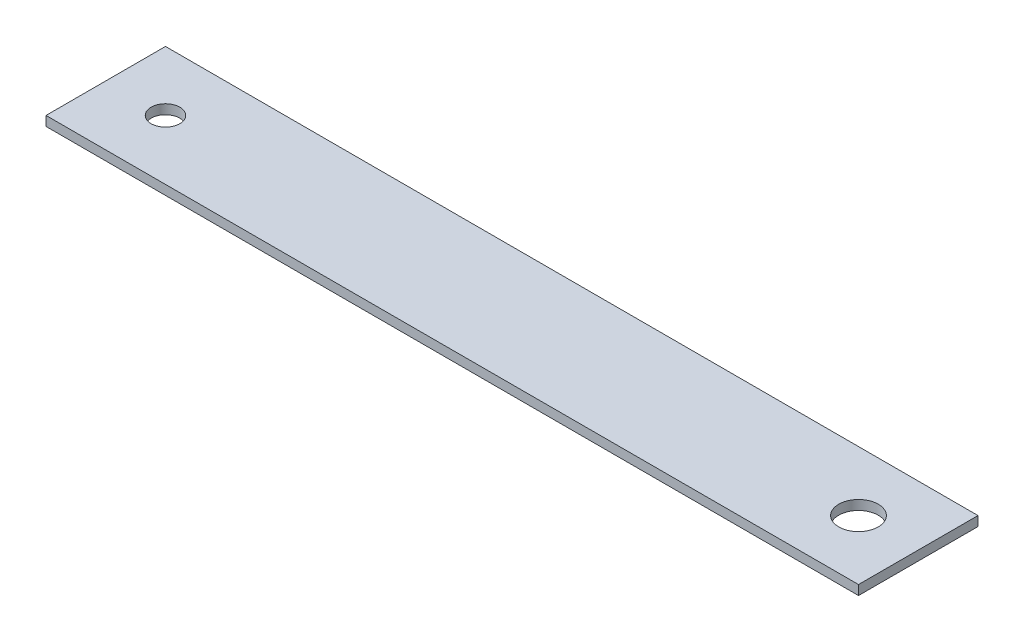
from build123d import *

# Parameters (mm, degrees)
SKETCH1_W           = 170
SKETCH1_H           = 25
SKETCH1_R           = 2
SKETCH1_R_2         = 4.125
BOSS_EXTRUDE1_DEPTH = 2
SKETCH2_R           = 3
CUT_EXTRUDE1_DEPTH  = 86.937477273
SKETCH1_3_R         = 2
BOSS_EXTRUDE2_DEPTH = 2


with BuildPart() as part:
    # Sketch1 → Boss-Extrude1 (new body)
    with BuildSketch(Plane(origin=(0, 0, 0), x_dir=(1, 0, 0), z_dir=(0, 1, 0))):
        Rectangle(SKETCH1_W, SKETCH1_H)
        with Locations((-28.158485727, -4.763382536)):
            Circle(SKETCH1_R, mode=Mode.SUBTRACT)
        with Locations((6.841514273, -4.763382536)):
            Circle(SKETCH1_R, mode=Mode.SUBTRACT)
        with Locations((72.5, 0)):
            Circle(SKETCH1_R_2, mode=Mode.SUBTRACT)
    extrude(amount=BOSS_EXTRUDE1_DEPTH)

    # Sketch2 → Cut-Extrude1 (cut, through all)
    with BuildSketch(Plane(origin=(0, 2, 0), x_dir=(1, 0, 0), z_dir=(0, 1, 0))):
        with Locations((-72.5, 0)):
            Circle(SKETCH2_R)
    extrude(amount=-CUT_EXTRUDE1_DEPTH, mode=Mode.SUBTRACT)

    # Sketch1<3> → Boss-Extrude2 (add)
    with BuildSketch(Plane(origin=(0, 0, 0), x_dir=(1, 0, 0), z_dir=(0, 1, 0))):
        with Locations((-28.158485727, -4.763382536)):
            Circle(SKETCH1_3_R)
        with Locations((6.841514273, -4.763382536)):
            Circle(SKETCH1_3_R)
    extrude(amount=BOSS_EXTRUDE2_DEPTH)


solid = part.part
